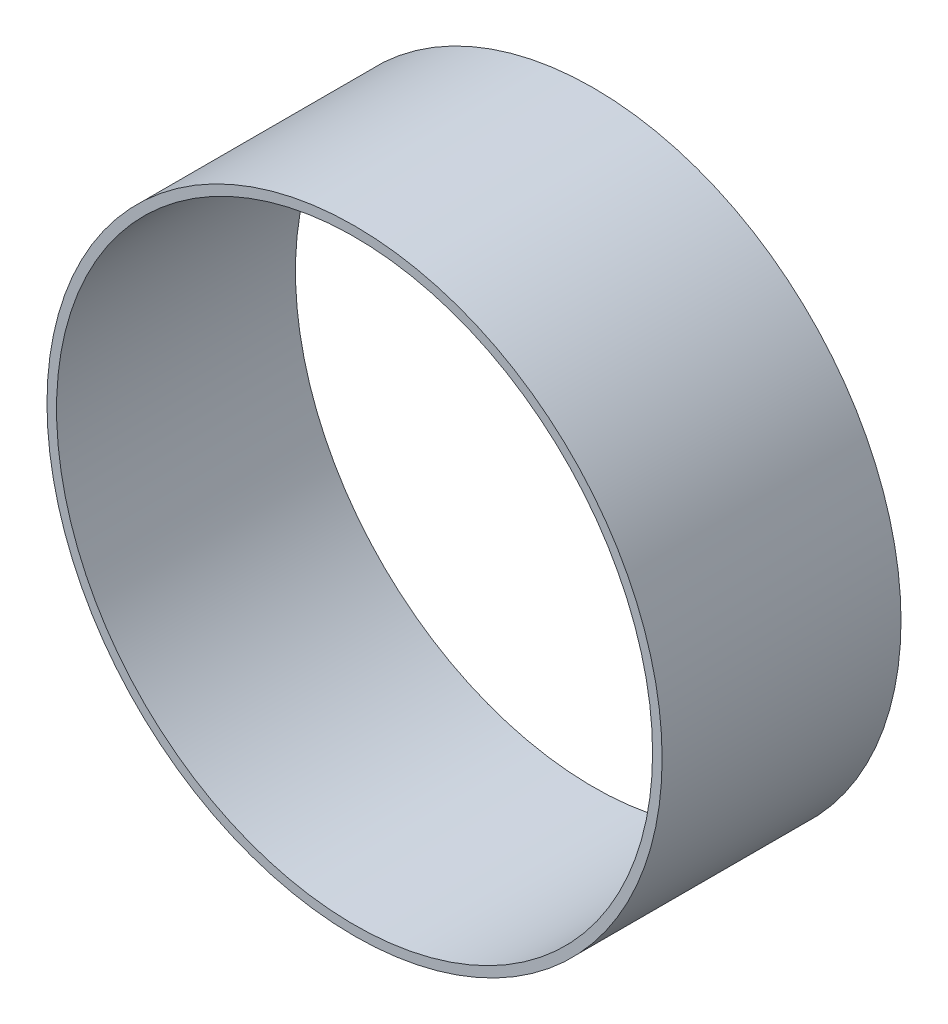
from build123d import *

# Parameters (mm, degrees)
SKETCH1_R           = 65.405
SKETCH1_R_2         = 63.373
BOSS_EXTRUDE1_DEPTH = 25.4


with BuildPart() as part:
    # Sketch1 → Boss-Extrude1 (new, symmetric)
    with BuildSketch(Plane.XY):
        Circle(SKETCH1_R)
        Circle(SKETCH1_R_2, mode=Mode.SUBTRACT)
    extrude(amount=BOSS_EXTRUDE1_DEPTH, both=True)


solid = part.part
